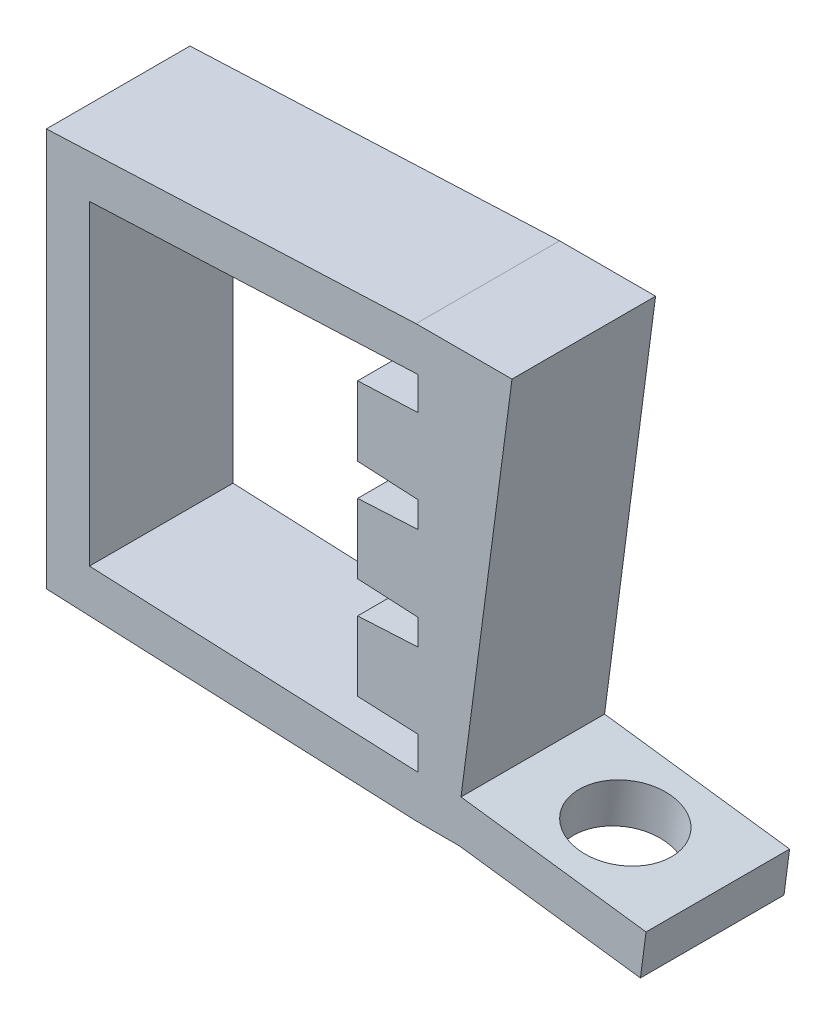
from build123d import *

# Parameters (mm, degrees)
BOSS_EXTRUDE1_DEPTH = 10
SKETCH2_R           = 3.25
CUT_EXTRUDE1_DEPTH  = 10


with BuildPart() as part:
    # Sketch1 → Boss-Extrude1 (new body)
    with BuildSketch(Plane.XY):
        Polygon((-3, -2.871875227), (22.747346112, -3.996028635), (25.747346112, -3.996028635), (38.375408895, -5.658544641), (38.766987472, -2.684210056), (25.878204274, -0.987369558), (29.43063604, 25.996028635), (22.747346112, 25.996028635), (-3, 24.871875227), align=None)
        Polygon((0, 0), (22.878204274, -0.998883971), (22.878204274, 1.301116029), (18.678204274, 1.48449199), (18.678204274, 6.334680433), (22.878204274, 6.554793106), (22.878204274, 8.354793106), (18.678204274, 8.574905779), (18.678204274, 13.425094221), (22.878204274, 13.645206894), (22.878204274, 15.445206894), (18.678204274, 15.665319567), (18.678204274, 20.51550801), (22.878204274, 20.698883971), (22.878204274, 22.998883971), (0, 22), align=None, mode=Mode.SUBTRACT)
    extrude(amount=BOSS_EXTRUDE1_DEPTH)

    # Sketch2 → Cut-Extrude1 (cut)
    with BuildSketch(Plane(origin=(-2.976585142, -0.214451345, 0), x_dir=(0.99144486137381, -0.13052619222005532, 0), z_dir=(0.13052619222005532, 0.99144486137381, 0))):
        with Locations((35.208818764, -5)):
            Circle(SKETCH2_R)
    extrude(amount=CUT_EXTRUDE1_DEPTH, mode=Mode.SUBTRACT)


solid = part.part
